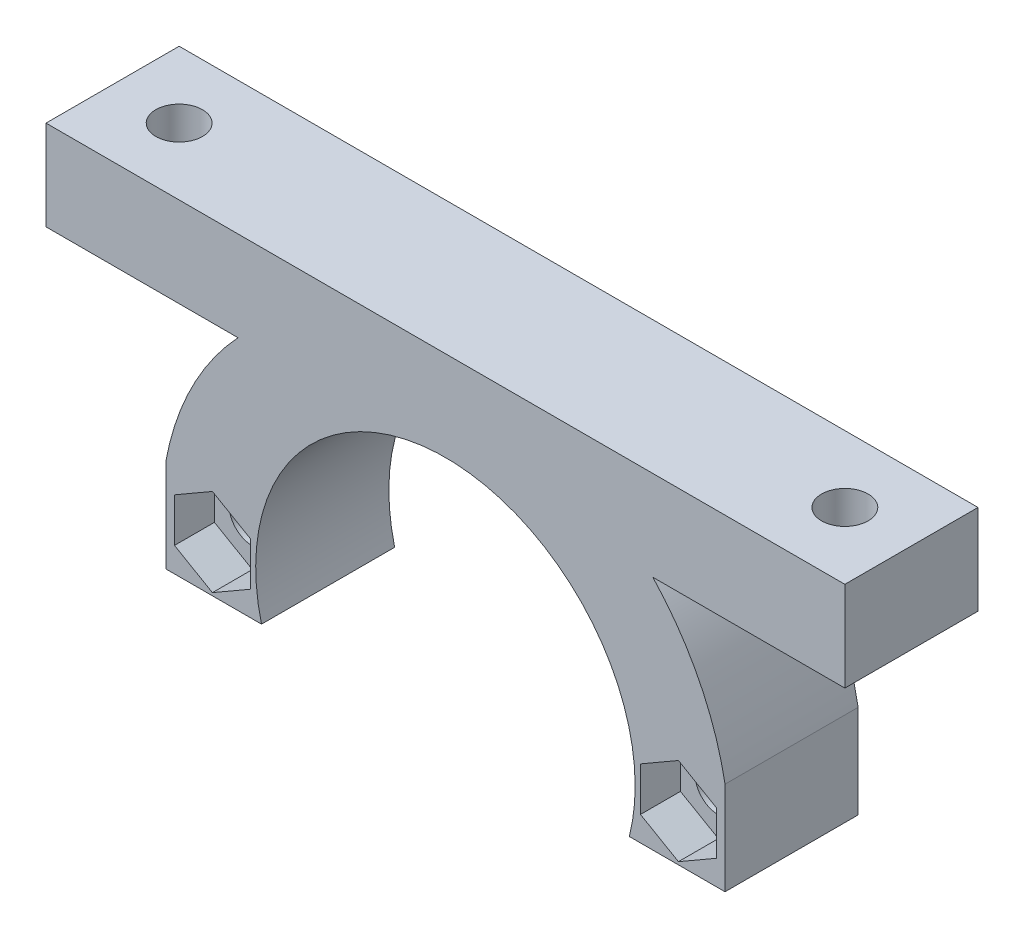
from build123d import *

# Parameters (mm, degrees)
ESQUISSE1_R             = 1.75
BOSS_EXTRU_1_DEPTH      = 10
ESQUISSE3_W             = 60
ESQUISSE3_H             = 6.75
BOSS_EXTRU_2_DEPTH      = 10
ENL_V_MAT_EXTRU_1_REACH = 42.003
ESQUISSE4_R             = 1.75
ENL_V_MAT_EXTRU_2_DEPTH = 3
ENL_V_MAT_EXTRU_3_DEPTH = 3


with BuildPart() as part:
    # Esquisse1 → Boss.-Extru.1 (new body)
    with BuildSketch(Plane.XY):
        with BuildLine():
            Line((-21, 3.5), (-21, -3.5))
            Line((-21, -3.5), (-13.813489784, -3.5))
            ThreePointArc((-13.813489784, -3.5), (0, 14.25), (13.813489784, -3.5))
            Line((13.813489784, -3.5), (21, -3.5))
            Line((21, -3.5), (21, 3.5))
            ThreePointArc((21, 3.5), (0, 21), (-21, 3.5))
        make_face()
        with Locations((-17.5, 0)):
            Circle(ESQUISSE1_R, mode=Mode.SUBTRACT)
        with Locations((17.5, 0)):
            Circle(ESQUISSE1_R, mode=Mode.SUBTRACT)
    extrude(amount=BOSS_EXTRU_1_DEPTH)

    # Esquisse3 → Boss.-Extru.2 (add)
    with BuildSketch(Plane.XY):
        with Locations((0, 17.625)):
            Rectangle(ESQUISSE3_W, ESQUISSE3_H)
    extrude(amount=BOSS_EXTRU_2_DEPTH)

    # Esquisse4 → Enlèv. mat.-Extru.1 (cut, up to next)
    with BuildSketch(Plane(origin=(0, 21, 0), x_dir=(1, 0, 0), z_dir=(0, 1, 0)), mode=Mode.PRIVATE) as enl_v_mat_extru_1_sk1:
        with Locations((-25, -5)):
            Circle(ESQUISSE4_R)
    enl_v_mat_extru_1_tool1 = extrude(enl_v_mat_extru_1_sk1.sketch, amount=-ENL_V_MAT_EXTRU_1_REACH, mode=Mode.PRIVATE) & part.part
    # Esquisse4 → Enlèv. mat.-Extru.1 (cut, up to next)
    with BuildSketch(Plane(origin=(0, 21, 0), x_dir=(1, 0, 0), z_dir=(0, 1, 0)), mode=Mode.PRIVATE) as enl_v_mat_extru_1_sk2:
        with Locations((25, -5)):
            Circle(ESQUISSE4_R)
    enl_v_mat_extru_1_tool2 = extrude(enl_v_mat_extru_1_sk2.sketch, amount=-ENL_V_MAT_EXTRU_1_REACH, mode=Mode.PRIVATE) & part.part
    add(enl_v_mat_extru_1_tool1.solids().sort_by_distance((-25, 21, 5))[0], mode=Mode.SUBTRACT)
    add(enl_v_mat_extru_1_tool2.solids().sort_by_distance((25, 21, 5))[0], mode=Mode.SUBTRACT)

    # Esquisse5 → Enlèv. mat.-Extru.2 (cut)
    with BuildSketch(Plane.XZ.offset(-14.25)):
        Polygon((25, 8.290896534), (22.15, 6.645448267), (22.15, 3.354551733), (25, 1.709103466), (27.85, 3.354551733), (27.85, 6.645448267), align=None)
        Polygon((-25, 8.290896534), (-27.85, 6.645448267), (-27.85, 3.354551733), (-25, 1.709103466), (-22.15, 3.354551733), (-22.15, 6.645448267), align=None)
    extrude(amount=-ENL_V_MAT_EXTRU_2_DEPTH, mode=Mode.SUBTRACT)

    # Esquisse6 → Enlèv. mat.-Extru.3 (cut)
    with BuildSketch(Plane.XY.offset(10)):
        Polygon((-17.5, 3.290896534), (-20.35, 1.645448267), (-20.35, -1.645448267), (-17.5, -3.290896534), (-14.65, -1.645448267), (-14.65, 1.645448267), align=None)
        Polygon((17.5, 3.290896534), (14.65, 1.645448267), (14.65, -1.645448267), (17.5, -3.290896534), (20.35, -1.645448267), (20.35, 1.645448267), align=None)
    extrude(amount=-ENL_V_MAT_EXTRU_3_DEPTH, mode=Mode.SUBTRACT)


solid = part.part
